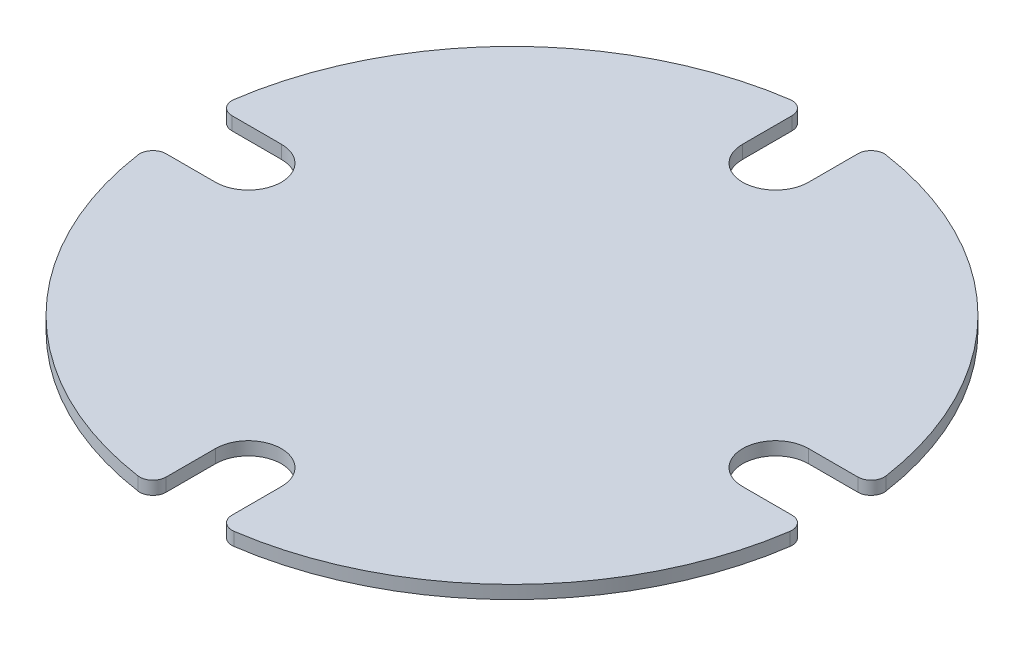
from build123d import *

# Parameters (mm, degrees)
SKETCH3_R                = 63.5
BOSS_EXTRUDE1_DEPTH      = 2.54
CUT_EXTRUDE1_REACH       = 91.838
FILLET1_R                = 2.54
CIRPATTERN1_COUNT        = 4
FILLET1_OF_CIRPATTERN1_R = 2.54


with BuildPart() as part:
    # Sketch3 → Boss-Extrude1 (new body)
    with BuildSketch(Plane(origin=(0, 0, 0), x_dir=(1, 0, 0), z_dir=(0, 1, 0))):
        Circle(SKETCH3_R)
    extrude(amount=BOSS_EXTRUDE1_DEPTH)

    # Sketch4 → Cut-Extrude1 (cut, up to next)
    with BuildSketch(Plane(origin=(0, 2.54, 0), x_dir=(1, 0, 0), z_dir=(0, 1, 0)), mode=Mode.PRIVATE) as cut_extrude1_sk1:
        with BuildLine():
            Line((-6.35, 50.8), (-6.35, 63.5))
            Line((-6.35, 63.5), (6.35, 63.5))
            Line((6.35, 63.5), (6.35, 50.8))
            ThreePointArc((6.35, 50.8), (0, 44.45), (-6.35, 50.8))
        make_face()
    cut_extrude1_tool1 = extrude(cut_extrude1_sk1.sketch, amount=-CUT_EXTRUDE1_REACH, mode=Mode.PRIVATE) & part.part
    cut_extrude1 = cut_extrude1_tool1.solids().sort_by_distance((0, 2.54, -54.599576))[0]
    add(cut_extrude1, mode=Mode.SUBTRACT)

    # Fillet1
    fillet1_edges = [part.edges().sort_by_distance(p)[0] for p in [
        (6.35, 1.27, -63.181702256),
        (-6.35, 1.27, -63.181702256),
    ]]
    fillet(fillet1_edges, radius=FILLET1_R)

    # CirPattern1: Cut-Extrude1 ×4 about axis
    cirpattern1_axis = Axis((0, 2.54, 0), (0, -1, 0))
    for i in range(1, CIRPATTERN1_COUNT):
        add(cut_extrude1.rotate(cirpattern1_axis, i * 360 / CIRPATTERN1_COUNT), mode=Mode.SUBTRACT)

    # Fillet1 of CirPattern1
    fillet1_of_cirpattern1_edges = [part.edges().sort_by_distance(p)[0] for p in [
        (63.181702256, 1.27, 6.35),
        (63.181702256, 1.27, -6.35),
        (-6.35, 1.27, 63.181702256),
        (6.35, 1.27, 63.181702256),
        (-63.181702256, 1.27, -6.35),
        (-63.181702256, 1.27, 6.35),
    ]]
    fillet(fillet1_of_cirpattern1_edges, radius=FILLET1_OF_CIRPATTERN1_R)


solid = part.part
